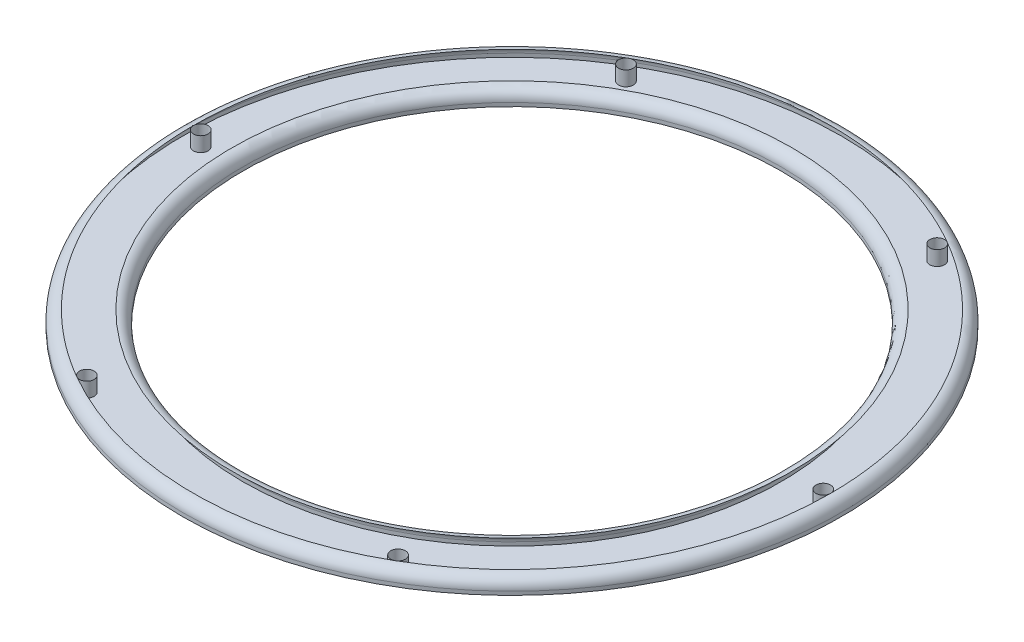
from build123d import *

# Parameters (mm, degrees)
SKETCH2_R          = 2
CUT_EXTRUDE1_DEPTH = 128.342059109
CIRPATTERN1_COUNT  = 6


with BuildPart() as part:
    # Sketch1 → Revolve1 (revolve)
    with BuildSketch(Plane.XY):
        with BuildLine():
            Line((-73.5, 0), (-90, 0))
            Line((-90, 0), (-90, 1))
            ThreePointArc((-90, 1), (-89.121320344, 3.121320344), (-87, 4))
            Line((-87, 4), (-76.5, 4))
            ThreePointArc((-76.5, 4), (-74.378679656, 3.121320344), (-73.5, 1))
            Line((-73.5, 1), (-73.5, 0))
        make_face()
    revolve(axis=Axis((0, 0, 0), (0, 1, 0)))

    # Sketch2 → Cut-Extrude1 (cut, through all)
    with BuildSketch(Plane(origin=(0, 4, 0), x_dir=(1, 0, 0), z_dir=(0, 1, 0))):
        with Locations((-85, 0)):
            Circle(SKETCH2_R)
    cut_extrude1 = extrude(amount=-CUT_EXTRUDE1_DEPTH, mode=Mode.SUBTRACT)

    # CirPattern1: Cut-Extrude1 ×6 about axis
    cirpattern1_axis = Axis((0, 0, 0), (0, -1, 0))
    for i in range(1, CIRPATTERN1_COUNT):
        add(cut_extrude1.rotate(cirpattern1_axis, i * 360 / CIRPATTERN1_COUNT), mode=Mode.SUBTRACT)


solid = part.part
